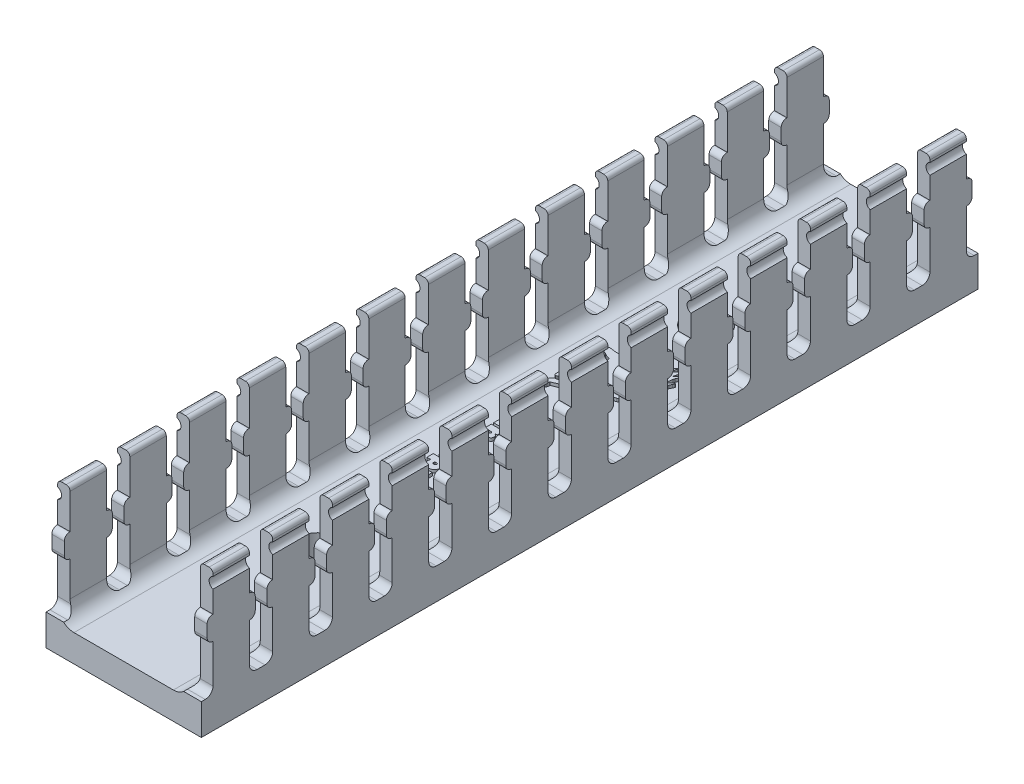
from build123d import *

# Parameters (mm, degrees)
BOSS_EXTRUDE1_DEPTH = 100
CUT_EXTRUDE1_DEPTH  = 104.556747728
SKETCH3_R           = 2.6
CUT_EXTRUDE2_DEPTH  = 104.006067899
BOSS_EXTRUDE2_DEPTH = 0.4
BOSS_EXTRUDE3_DEPTH = 0.4


with BuildPart() as part:
    # Sketch1 → Boss-Extrude1 (new body)
    with BuildSketch(Plane.XY):
        with BuildLine():
            Line((18.9, 18), (19.5, 18))
            ThreePointArc((19.5, 18), (19.853553391, 17.853553391), (20, 17.5))
            Line((20, 17.5), (20, 17.207106781))
            ThreePointArc((20, 17.207106781), (19.5, 16.5), (20, 15.792893219))
            Line((20, 15.792893219), (20, 0))
            Line((20, 0), (0, 0))
            Line((0, 0), (0, 15.792893219))
            ThreePointArc((0, 15.792893219), (0.5, 16.5), (0, 17.207106781))
            Line((0, 17.207106781), (0, 17.5))
            ThreePointArc((0, 17.5), (0.146446609, 17.853553391), (0.5, 18))
            Line((0.5, 18), (1.1, 18))
            ThreePointArc((1.1, 18), (1.453553391, 17.853553391), (1.6, 17.5))
            Line((1.6, 17.5), (1.6, 5.5))
            ThreePointArc((1.6, 5.5), (2.185786438, 4.085786438), (3.6, 3.5))
            Line((3.6, 3.5), (16.4, 3.5))
            ThreePointArc((16.4, 3.5), (17.814213562, 4.085786438), (18.4, 5.5))
            Line((18.4, 5.5), (18.4, 17.5))
            ThreePointArc((18.4, 17.5), (18.546446609, 17.853553391), (18.9, 18))
        make_face()
    extrude(amount=BOSS_EXTRUDE1_DEPTH)

    # Sketch2 → Cut-Extrude1 (cut, through all)
    with BuildSketch(Plane.ZY):
        with BuildLine():
            Line((-0.5, 4), (0.5, 4))
            ThreePointArc((0.5, 4), (1.207106781, 4.292893219), (1.5, 5))
            Line((1.5, 5), (1.5, 10))
            Line((1.5, 10), (1.45, 10))
            ThreePointArc((1.45, 10), (0.955025253, 10.205025253), (0.75, 10.7))
            Line((0.75, 10.7), (0.75, 12.3))
            ThreePointArc((0.75, 12.3), (0.955025253, 12.794974747), (1.45, 13))
            Line((1.45, 13), (1.5, 13))
            Line((1.5, 13), (1.5, 18))
            Line((1.5, 18), (-1.5, 18))
            Line((-1.5, 18), (-1.5, 13))
            Line((-1.5, 13), (-1.45, 13))
            ThreePointArc((-1.45, 13), (-0.955025253, 12.794974747), (-0.75, 12.3))
            Line((-0.75, 12.3), (-0.75, 10.7))
            ThreePointArc((-0.75, 10.7), (-0.955025253, 10.205025253), (-1.45, 10))
            Line((-1.45, 10), (-1.5, 10))
            Line((-1.5, 10), (-1.5, 5))
            ThreePointArc((-1.5, 5), (-1.207106781, 4.292893219), (-0.5, 4))
        make_face()
        with BuildLine():
            Line((7.192307692, 4), (8.192307692, 4))
            ThreePointArc((8.192307692, 4), (8.899414473, 4.292893219), (9.192307692, 5))
            Line((9.192307692, 5), (9.192307692, 10))
            Line((9.192307692, 10), (9.142307692, 10))
            ThreePointArc((9.142307692, 10), (8.647332945, 10.205025253), (8.442307692, 10.7))
            Line((8.442307692, 10.7), (8.442307692, 12.3))
            ThreePointArc((8.442307692, 12.3), (8.647332945, 12.794974747), (9.142307692, 13))
            Line((9.142307692, 13), (9.192307692, 13))
            Line((9.192307692, 13), (9.192307692, 18))
            Line((9.192307692, 18), (6.192307692, 18))
            Line((6.192307692, 18), (6.192307692, 13))
            Line((6.192307692, 13), (6.242307692, 13))
            ThreePointArc((6.242307692, 13), (6.737282439, 12.794974747), (6.942307692, 12.3))
            Line((6.942307692, 12.3), (6.942307692, 10.7))
            ThreePointArc((6.942307692, 10.7), (6.737282439, 10.205025253), (6.242307692, 10))
            Line((6.242307692, 10), (6.192307692, 10))
            Line((6.192307692, 10), (6.192307692, 5))
            ThreePointArc((6.192307692, 5), (6.485200911, 4.292893219), (7.192307692, 4))
        make_face()
        with BuildLine():
            Line((14.884615385, 4), (15.884615385, 4))
            ThreePointArc((15.884615385, 4), (16.591722166, 4.292893219), (16.884615385, 5))
            Line((16.884615385, 5), (16.884615385, 10))
            Line((16.884615385, 10), (16.834615385, 10))
            ThreePointArc((16.834615385, 10), (16.339640638, 10.205025253), (16.134615385, 10.7))
            Line((16.134615385, 10.7), (16.134615385, 12.3))
            ThreePointArc((16.134615385, 12.3), (16.339640638, 12.794974747), (16.834615385, 13))
            Line((16.834615385, 13), (16.884615385, 13))
            Line((16.884615385, 13), (16.884615385, 18))
            Line((16.884615385, 18), (13.884615385, 18))
            Line((13.884615385, 18), (13.884615385, 13))
            Line((13.884615385, 13), (13.934615385, 13))
            ThreePointArc((13.934615385, 13), (14.429590131, 12.794974747), (14.634615385, 12.3))
            Line((14.634615385, 12.3), (14.634615385, 10.7))
            ThreePointArc((14.634615385, 10.7), (14.429590131, 10.205025253), (13.934615385, 10))
            Line((13.934615385, 10), (13.884615385, 10))
            Line((13.884615385, 10), (13.884615385, 5))
            ThreePointArc((13.884615385, 5), (14.177508603, 4.292893219), (14.884615385, 4))
        make_face()
        with BuildLine():
            Line((22.576923077, 4), (23.576923077, 4))
            ThreePointArc((23.576923077, 4), (24.284029858, 4.292893219), (24.576923077, 5))
            Line((24.576923077, 5), (24.576923077, 10))
            Line((24.576923077, 10), (24.526923077, 10))
            ThreePointArc((24.526923077, 10), (24.03194833, 10.205025253), (23.826923077, 10.7))
            Line((23.826923077, 10.7), (23.826923077, 12.3))
            ThreePointArc((23.826923077, 12.3), (24.03194833, 12.794974747), (24.526923077, 13))
            Line((24.526923077, 13), (24.576923077, 13))
            Line((24.576923077, 13), (24.576923077, 18))
            Line((24.576923077, 18), (21.576923077, 18))
            Line((21.576923077, 18), (21.576923077, 13))
            Line((21.576923077, 13), (21.626923077, 13))
            ThreePointArc((21.626923077, 13), (22.121897824, 12.794974747), (22.326923077, 12.3))
            Line((22.326923077, 12.3), (22.326923077, 10.7))
            ThreePointArc((22.326923077, 10.7), (22.121897824, 10.205025253), (21.626923077, 10))
            Line((21.626923077, 10), (21.576923077, 10))
            Line((21.576923077, 10), (21.576923077, 5))
            ThreePointArc((21.576923077, 5), (21.869816296, 4.292893219), (22.576923077, 4))
        make_face()
        with BuildLine():
            Line((30.269230769, 4), (31.269230769, 4))
            ThreePointArc((31.269230769, 4), (31.97633755, 4.292893219), (32.269230769, 5))
            Line((32.269230769, 5), (32.269230769, 10))
            Line((32.269230769, 10), (32.219230769, 10))
            ThreePointArc((32.219230769, 10), (31.724256022, 10.205025253), (31.519230769, 10.7))
            Line((31.519230769, 10.7), (31.519230769, 12.3))
            ThreePointArc((31.519230769, 12.3), (31.724256022, 12.794974747), (32.219230769, 13))
            Line((32.219230769, 13), (32.269230769, 13))
            Line((32.269230769, 13), (32.269230769, 18))
            Line((32.269230769, 18), (29.269230769, 18))
            Line((29.269230769, 18), (29.269230769, 13))
            Line((29.269230769, 13), (29.319230769, 13))
            ThreePointArc((29.319230769, 13), (29.814205516, 12.794974747), (30.019230769, 12.3))
            Line((30.019230769, 12.3), (30.019230769, 10.7))
            ThreePointArc((30.019230769, 10.7), (29.814205516, 10.205025253), (29.319230769, 10))
            Line((29.319230769, 10), (29.269230769, 10))
            Line((29.269230769, 10), (29.269230769, 5))
            ThreePointArc((29.269230769, 5), (29.562123988, 4.292893219), (30.269230769, 4))
        make_face()
        with BuildLine():
            Line((37.961538462, 4), (38.961538462, 4))
            ThreePointArc((38.961538462, 4), (39.668645243, 4.292893219), (39.961538462, 5))
            Line((39.961538462, 5), (39.961538462, 10))
            Line((39.961538462, 10), (39.911538462, 10))
            ThreePointArc((39.911538462, 10), (39.416563715, 10.205025253), (39.211538462, 10.7))
            Line((39.211538462, 10.7), (39.211538462, 12.3))
            ThreePointArc((39.211538462, 12.3), (39.416563715, 12.794974747), (39.911538462, 13))
            Line((39.911538462, 13), (39.961538462, 13))
            Line((39.961538462, 13), (39.961538462, 18))
            Line((39.961538462, 18), (36.961538462, 18))
            Line((36.961538462, 18), (36.961538462, 13))
            Line((36.961538462, 13), (37.011538462, 13))
            ThreePointArc((37.011538462, 13), (37.506513208, 12.794974747), (37.711538462, 12.3))
            Line((37.711538462, 12.3), (37.711538462, 10.7))
            ThreePointArc((37.711538462, 10.7), (37.506513208, 10.205025253), (37.011538462, 10))
            Line((37.011538462, 10), (36.961538462, 10))
            Line((36.961538462, 10), (36.961538462, 5))
            ThreePointArc((36.961538462, 5), (37.25443168, 4.292893219), (37.961538462, 4))
        make_face()
        with BuildLine():
            Line((45.653846154, 4), (46.653846154, 4))
            ThreePointArc((46.653846154, 4), (47.360952935, 4.292893219), (47.653846154, 5))
            Line((47.653846154, 5), (47.653846154, 10))
            Line((47.653846154, 10), (47.603846154, 10))
            ThreePointArc((47.603846154, 10), (47.108871407, 10.205025253), (46.903846154, 10.7))
            Line((46.903846154, 10.7), (46.903846154, 12.3))
            ThreePointArc((46.903846154, 12.3), (47.108871407, 12.794974747), (47.603846154, 13))
            Line((47.603846154, 13), (47.653846154, 13))
            Line((47.653846154, 13), (47.653846154, 18))
            Line((47.653846154, 18), (44.653846154, 18))
            Line((44.653846154, 18), (44.653846154, 13))
            Line((44.653846154, 13), (44.703846154, 13))
            ThreePointArc((44.703846154, 13), (45.198820901, 12.794974747), (45.403846154, 12.3))
            Line((45.403846154, 12.3), (45.403846154, 10.7))
            ThreePointArc((45.403846154, 10.7), (45.198820901, 10.205025253), (44.703846154, 10))
            Line((44.703846154, 10), (44.653846154, 10))
            Line((44.653846154, 10), (44.653846154, 5))
            ThreePointArc((44.653846154, 5), (44.946739373, 4.292893219), (45.653846154, 4))
        make_face()
        with BuildLine():
            Line((53.346153846, 4), (54.346153846, 4))
            ThreePointArc((54.346153846, 4), (55.053260627, 4.292893219), (55.346153846, 5))
            Line((55.346153846, 5), (55.346153846, 10))
            Line((55.346153846, 10), (55.296153846, 10))
            ThreePointArc((55.296153846, 10), (54.801179099, 10.205025253), (54.596153846, 10.7))
            Line((54.596153846, 10.7), (54.596153846, 12.3))
            ThreePointArc((54.596153846, 12.3), (54.801179099, 12.794974747), (55.296153846, 13))
            Line((55.296153846, 13), (55.346153846, 13))
            Line((55.346153846, 13), (55.346153846, 18))
            Line((55.346153846, 18), (52.346153846, 18))
            Line((52.346153846, 18), (52.346153846, 13))
            Line((52.346153846, 13), (52.396153846, 13))
            ThreePointArc((52.396153846, 13), (52.891128593, 12.794974747), (53.096153846, 12.3))
            Line((53.096153846, 12.3), (53.096153846, 10.7))
            ThreePointArc((53.096153846, 10.7), (52.891128593, 10.205025253), (52.396153846, 10))
            Line((52.396153846, 10), (52.346153846, 10))
            Line((52.346153846, 10), (52.346153846, 5))
            ThreePointArc((52.346153846, 5), (52.639047065, 4.292893219), (53.346153846, 4))
        make_face()
        with BuildLine():
            Line((61.038461538, 4), (62.038461538, 4))
            ThreePointArc((62.038461538, 4), (62.74556832, 4.292893219), (63.038461538, 5))
            Line((63.038461538, 5), (63.038461538, 10))
            Line((63.038461538, 10), (62.988461538, 10))
            ThreePointArc((62.988461538, 10), (62.493486792, 10.205025253), (62.288461538, 10.7))
            Line((62.288461538, 10.7), (62.288461538, 12.3))
            ThreePointArc((62.288461538, 12.3), (62.493486792, 12.794974747), (62.988461538, 13))
            Line((62.988461538, 13), (63.038461538, 13))
            Line((63.038461538, 13), (63.038461538, 18))
            Line((63.038461538, 18), (60.038461538, 18))
            Line((60.038461538, 18), (60.038461538, 13))
            Line((60.038461538, 13), (60.088461538, 13))
            ThreePointArc((60.088461538, 13), (60.583436285, 12.794974747), (60.788461538, 12.3))
            Line((60.788461538, 12.3), (60.788461538, 10.7))
            ThreePointArc((60.788461538, 10.7), (60.583436285, 10.205025253), (60.088461538, 10))
            Line((60.088461538, 10), (60.038461538, 10))
            Line((60.038461538, 10), (60.038461538, 5))
            ThreePointArc((60.038461538, 5), (60.331354757, 4.292893219), (61.038461538, 4))
        make_face()
        with BuildLine():
            Line((68.730769231, 4), (69.730769231, 4))
            ThreePointArc((69.730769231, 4), (70.437876012, 4.292893219), (70.730769231, 5))
            Line((70.730769231, 5), (70.730769231, 10))
            Line((70.730769231, 10), (70.680769231, 10))
            ThreePointArc((70.680769231, 10), (70.185794484, 10.205025253), (69.980769231, 10.7))
            Line((69.980769231, 10.7), (69.980769231, 12.3))
            ThreePointArc((69.980769231, 12.3), (70.185794484, 12.794974747), (70.680769231, 13))
            Line((70.680769231, 13), (70.730769231, 13))
            Line((70.730769231, 13), (70.730769231, 18))
            Line((70.730769231, 18), (67.730769231, 18))
            Line((67.730769231, 18), (67.730769231, 13))
            Line((67.730769231, 13), (67.780769231, 13))
            ThreePointArc((67.780769231, 13), (68.275743978, 12.794974747), (68.480769231, 12.3))
            Line((68.480769231, 12.3), (68.480769231, 10.7))
            ThreePointArc((68.480769231, 10.7), (68.275743978, 10.205025253), (67.780769231, 10))
            Line((67.780769231, 10), (67.730769231, 10))
            Line((67.730769231, 10), (67.730769231, 5))
            ThreePointArc((67.730769231, 5), (68.02366245, 4.292893219), (68.730769231, 4))
        make_face()
        with BuildLine():
            Line((76.423076923, 4), (77.423076923, 4))
            ThreePointArc((77.423076923, 4), (78.130183704, 4.292893219), (78.423076923, 5))
            Line((78.423076923, 5), (78.423076923, 10))
            Line((78.423076923, 10), (78.373076923, 10))
            ThreePointArc((78.373076923, 10), (77.878102176, 10.205025253), (77.673076923, 10.7))
            Line((77.673076923, 10.7), (77.673076923, 12.3))
            ThreePointArc((77.673076923, 12.3), (77.878102176, 12.794974747), (78.373076923, 13))
            Line((78.373076923, 13), (78.423076923, 13))
            Line((78.423076923, 13), (78.423076923, 18))
            Line((78.423076923, 18), (75.423076923, 18))
            Line((75.423076923, 18), (75.423076923, 13))
            Line((75.423076923, 13), (75.473076923, 13))
            ThreePointArc((75.473076923, 13), (75.96805167, 12.794974747), (76.173076923, 12.3))
            Line((76.173076923, 12.3), (76.173076923, 10.7))
            ThreePointArc((76.173076923, 10.7), (75.96805167, 10.205025253), (75.473076923, 10))
            Line((75.473076923, 10), (75.423076923, 10))
            Line((75.423076923, 10), (75.423076923, 5))
            ThreePointArc((75.423076923, 5), (75.715970142, 4.292893219), (76.423076923, 4))
        make_face()
        with BuildLine():
            Line((84.115384615, 4), (85.115384615, 4))
            ThreePointArc((85.115384615, 4), (85.822491397, 4.292893219), (86.115384615, 5))
            Line((86.115384615, 5), (86.115384615, 10))
            Line((86.115384615, 10), (86.065384615, 10))
            ThreePointArc((86.065384615, 10), (85.570409869, 10.205025253), (85.365384615, 10.7))
            Line((85.365384615, 10.7), (85.365384615, 12.3))
            ThreePointArc((85.365384615, 12.3), (85.570409869, 12.794974747), (86.065384615, 13))
            Line((86.065384615, 13), (86.115384615, 13))
            Line((86.115384615, 13), (86.115384615, 18))
            Line((86.115384615, 18), (83.115384615, 18))
            Line((83.115384615, 18), (83.115384615, 13))
            Line((83.115384615, 13), (83.165384615, 13))
            ThreePointArc((83.165384615, 13), (83.660359362, 12.794974747), (83.865384615, 12.3))
            Line((83.865384615, 12.3), (83.865384615, 10.7))
            ThreePointArc((83.865384615, 10.7), (83.660359362, 10.205025253), (83.165384615, 10))
            Line((83.165384615, 10), (83.115384615, 10))
            Line((83.115384615, 10), (83.115384615, 5))
            ThreePointArc((83.115384615, 5), (83.408277834, 4.292893219), (84.115384615, 4))
        make_face()
        with BuildLine():
            Line((91.807692308, 4), (92.807692308, 4))
            ThreePointArc((92.807692308, 4), (93.514799089, 4.292893219), (93.807692308, 5))
            Line((93.807692308, 5), (93.807692308, 10))
            Line((93.807692308, 10), (93.757692308, 10))
            ThreePointArc((93.757692308, 10), (93.262717561, 10.205025253), (93.057692308, 10.7))
            Line((93.057692308, 10.7), (93.057692308, 12.3))
            ThreePointArc((93.057692308, 12.3), (93.262717561, 12.794974747), (93.757692308, 13))
            Line((93.757692308, 13), (93.807692308, 13))
            Line((93.807692308, 13), (93.807692308, 18))
            Line((93.807692308, 18), (90.807692308, 18))
            Line((90.807692308, 18), (90.807692308, 13))
            Line((90.807692308, 13), (90.857692308, 13))
            ThreePointArc((90.857692308, 13), (91.352667055, 12.794974747), (91.557692308, 12.3))
            Line((91.557692308, 12.3), (91.557692308, 10.7))
            ThreePointArc((91.557692308, 10.7), (91.352667055, 10.205025253), (90.857692308, 10))
            Line((90.857692308, 10), (90.807692308, 10))
            Line((90.807692308, 10), (90.807692308, 5))
            ThreePointArc((90.807692308, 5), (91.100585527, 4.292893219), (91.807692308, 4))
        make_face()
        with BuildLine():
            Line((99.5, 4), (100.5, 4))
            ThreePointArc((100.5, 4), (101.207106781, 4.292893219), (101.5, 5))
            Line((101.5, 5), (101.5, 10))
            Line((101.5, 10), (101.45, 10))
            ThreePointArc((101.45, 10), (100.955025253, 10.205025253), (100.75, 10.7))
            Line((100.75, 10.7), (100.75, 12.3))
            ThreePointArc((100.75, 12.3), (100.955025253, 12.794974747), (101.45, 13))
            Line((101.45, 13), (101.5, 13))
            Line((101.5, 13), (101.5, 18))
            Line((101.5, 18), (98.5, 18))
            Line((98.5, 18), (98.5, 13))
            Line((98.5, 13), (98.55, 13))
            ThreePointArc((98.55, 13), (99.044974747, 12.794974747), (99.25, 12.3))
            Line((99.25, 12.3), (99.25, 10.7))
            ThreePointArc((99.25, 10.7), (99.044974747, 10.205025253), (98.55, 10))
            Line((98.55, 10), (98.5, 10))
            Line((98.5, 10), (98.5, 5))
            ThreePointArc((98.5, 5), (98.792893219, 4.292893219), (99.5, 4))
        make_face()
    extrude(amount=-CUT_EXTRUDE1_DEPTH, mode=Mode.SUBTRACT)

    # Sketch3 → Cut-Extrude2 (cut, through all)
    with BuildSketch(Plane(origin=(0, 3.5, 0), x_dir=(1, 0, 0), z_dir=(0, 1, 0))):
        with Locations((10, -25)):
            Circle(SKETCH3_R)
        with Locations((10, -75)):
            Circle(SKETCH3_R)
    extrude(amount=-CUT_EXTRUDE2_DEPTH, mode=Mode.SUBTRACT)

    # Sketch5 → Boss-Extrude2 (add)
    with BuildSketch(Plane(origin=(2.865800493, 3.5, -37.480386566), x_dir=(1, 0, 0), z_dir=(0, 1, 0))):
        Polygon((12.100966892, -71.436643223), (12.11467057, -71.389617273), (12.079708439, -71.401613946), (12.04555004, -71.41492974), (12.012164966, -71.42950559), (11.979522808, -71.445282431), (11.947593159, -71.462201197), (11.916345609, -71.480202824), (11.88574975, -71.499228247), (11.855775175, -71.519218401), (11.826391475, -71.540114221), (11.797568242, -71.561856642), (11.769275066, -71.584386599), (11.741481541, -71.607645027), (11.714157258, -71.63157286), (11.660794784, -71.681200486), (11.583510179, -71.759185845), (11.315972457, -72.057260394), (11.322057411, -71.994274898), (11.457026474, -71.151822537), (11.461838625, -71.120101737), (11.467543035, -71.088672942), (11.474089535, -71.057519752), (11.481427956, -71.026625766), (11.498279887, -70.965549806), (11.517697482, -70.905313862), (11.55075654, -70.81624797), (11.729620086, -70.408683531), (11.775519845, -70.290546976), (11.745148512, -70.295900967), (11.715561816, -70.302766086), (11.686726412, -70.3110697), (11.658608952, -70.320739177), (11.631176091, -70.331701886), (11.604394482, -70.343885194), (11.578230779, -70.357216469), (11.552651635, -70.371623079), (11.527623705, -70.387032393), (11.503113642, -70.403371777), (11.4790881, -70.4205686), (11.455513733, -70.43855023), (11.409585136, -70.476577382), (11.365061083, -70.516872176), (11.279159523, -70.601940467), (11.091466646, -70.793932915), (11.111121267, -70.7091724), (11.155635515, -70.541181539), (11.206430997, -70.375104174), (11.292672243, -70.129243265), (11.509197294, -69.607695097), (11.491309846, -69.60960645), (11.456105432, -69.6153531), (11.421652842, -69.623517379), (11.387941493, -69.633922128), (11.338741142, -69.653342599), (11.29114905, -69.676807615), (11.215305789, -69.723279905), (11.063011614, -69.845578229), (10.677313831, -70.268847424), (10.549453829, -70.445689406), (10.381519842, -70.666292122), (10.531069748, -69.981539585), (10.609634043, -69.570531114), (10.571823714, -69.591783074), (10.535674259, -69.614647546), (10.501108461, -69.639043472), (10.468049103, -69.664889794), (10.436418969, -69.692105455), (10.406140841, -69.720609396), (10.377137504, -69.75032056), (10.349331739, -69.781157888), (10.32264633, -69.813040324), (10.297004059, -69.845886808), (10.272327712, -69.879616284), (10.248540069, -69.914147693), (10.225563915, -69.949399978), (10.203322032, -69.98529208), (10.160732213, -70.058671506), (10.100424098, -70.17151283), (9.945862574, -70.473231487), (9.905298881, -70.545332385), (9.86876705, -70.236548595), (9.854633501, -70.245400277), (9.827975459, -70.264675745), (9.803350582, -70.285895191), (9.780624175, -70.30887602), (9.759661545, -70.333435638), (9.731230037, -70.372835865), (9.69823743, -70.429191038), (9.617410212, -70.625694239), (9.598468184, -70.686080194), (9.409863745, -71.518454363), (9.297442291, -71.347754027), (9.281809574, -71.436764932), (9.210015106, -71.885042629), (9.189060794, -71.973144388), (9.172482006, -72.031203428), (9.153427216, -72.088613534), (9.131563335, -72.145281649), (9.119473894, -72.17330838), (9.106557272, -72.201114719), (9.034917781, -72.130719675), (8.916117918, -72.249525773), (8.872854665, -72.314086443), (8.854678116, -72.354859037), (8.84495761, -72.387618518), (8.839927938, -72.408850556), (8.827776868, -72.472878119), (8.815486987, -72.580491147), (8.794635922, -73.01424944), (8.69060925, -72.955782311), (8.673627111, -72.999373161), (8.644829875, -73.087991959), (8.622557018, -73.17823391), (8.603223574, -73.292783307), (8.591372055, -73.431898386), (8.592400982, -73.618246697), (8.49359264, -73.639163066), (8.470079751, -73.654432067), (8.459131619, -73.667697842), (8.453474206, -73.678604379), (8.449311778, -73.691358481), (8.44589947, -73.707040048), (8.441401599, -73.738322392), (8.439773621, -73.769487021), (8.440736615, -73.80052194), (8.444011664, -73.831415158), (8.456382248, -73.89272851), (8.542562939, -74.129915068), (8.386627955, -74.071919291), (8.392067413, -74.691386997), (8.390261584, -74.715039228), (8.387498798, -74.738419387), (8.383806828, -74.761522735), (8.379213444, -74.784344532), (8.373746417, -74.806880038), (8.367433518, -74.829124515), (8.36030252, -74.851073222), (8.352381192, -74.872721421), (8.343697307, -74.89406437), (8.334278635, -74.915097332), (8.313348017, -74.956214333), (8.289811507, -74.996034507), (8.263891275, -75.034519938), (8.235809491, -75.07163271), (8.205788326, -75.107334905), (8.157606232, -75.158160428), (8.106310233, -75.205598875), (8.052650153, -75.249522281), (8.005604859, -75.009097819), (8.011423944, -74.972177762), (8.018250421, -74.935524179), (8.026005087, -74.899116309), (8.034608743, -74.862933387), (8.054046211, -74.791159339), (8.087589786, -74.684666317), (8.223101076, -74.297657289), (8.244361635, -74.226437524), (8.26299882, -74.154539585), (8.271135643, -74.118284394), (8.278379017, -74.08179737), (8.284649741, -74.045057752), (8.289868613, -74.008044776), (8.293956431, -73.970737681), (8.297283604, -73.939856944), (8.302167608, -73.87788295), (8.304665172, -73.815721412), (8.30474511, -73.753487307), (8.302376238, -73.69129561), (8.29752737, -73.629261298), (8.290167323, -73.567499349), (8.28026491, -73.506124739), (8.267788948, -73.445252445), (8.252708251, -73.384997443), (8.234991635, -73.325474711), (8.214607916, -73.266799224), (8.191525907, -73.209085961), (8.165714424, -73.152449897), (8.137142283, -73.09700601), (8.062692647, -72.962171163), (8.010570766, -72.873329923), (7.956344141, -72.785593594), (7.899915308, -72.699190164), (7.841186798, -72.61434762), (7.780061147, -72.53129395), (7.748568935, -72.49050919), (7.716440888, -72.450257143), (7.683664822, -72.410566308), (7.650228555, -72.371465184), (7.616119902, -72.33298227), (7.581326681, -72.295146063), (7.545836709, -72.257985062), (7.509637801, -72.221527766), (7.472717776, -72.185802672), (7.435064449, -72.150838281), (7.396665637, -72.116663089), (7.357509157, -72.083305595), (7.317582826, -72.050794299), (7.27687446, -72.019157697), (7.235371877, -71.98842429), (7.193062892, -71.958622574), (6.622026328, -71.556560339), (6.585943606, -71.533506579), (6.135220615, -71.174355636), (6.032107543, -71.09097231), (5.931797706, -71.004338486), (5.802308401, -70.884112314), (5.677554365, -70.758928095), (5.557393736, -70.629254751), (5.413436308, -70.461564615), (5.249478585, -70.253334325), (5.167010913, -70.134652629), (5.138774148, -70.074512669), (5.130306063, -70.037559993), (5.128832282, -70.008295108), (5.128345853, -69.994514714), (5.128791136, -69.980872638), (5.130088602, -69.967357882), (5.134921955, -69.940666329), (5.142209664, -69.914352061), (5.197731287, -69.772435246), (5.208500661, -69.733324526), (5.212518249, -69.706860697), (5.213339852, -69.693478778), (5.213263953, -69.679982192), (5.21221102, -69.666359939), (5.210101522, -69.652601018), (5.206855928, -69.638694431), (5.202394708, -69.624629179), (5.044255478, -69.164968193), (4.957685888, -69.185230181), (4.832796788, -68.863274956), (4.759556079, -68.956672394), (4.586234914, -68.76416058), (4.523166652, -68.852885018), (4.480019014, -68.834549837), (4.30181836, -68.779828676), (4.178877168, -68.763372791), (4.084999464, -68.763605787), (4.080549464, -68.898207278), (3.886761497, -69.085123973), (3.957782774, -69.117937683), (4.088556656, -69.179940558), (4.119579515, -69.202269482), (4.138247365, -69.219398976), (4.154985945, -69.238656959), (4.162546574, -69.249173505), (4.169522664, -69.260329419), (4.17588014, -69.27216045), (4.181584929, -69.284702345), (4.186602956, -69.297990854), (4.05514173, -69.326800388), (4.064188834, -69.36946213), (4.096182787, -69.464968608), (4.23350752, -69.701450668), (4.195085023, -69.815628097), (4.194202994, -69.878750833), (4.205063736, -69.902537721), (4.237709828, -69.958277378), (4.432524827, -70.165140248), (4.446040728, -70.177385345), (4.484270541, -70.215997255), (4.541706711, -70.285444548), (4.749186783, -70.581749186), (4.786366383, -70.631631939), (4.824316507, -70.68082531), (4.863010491, -70.729349429), (4.902421672, -70.777224423), (4.942523385, -70.824470421), (4.983288968, -70.871107553), (5.024691756, -70.917155945), (5.066705087, -70.962635728), (5.109302297, -71.00756703), (5.196141697, -71.095864703), (5.284996649, -71.182209993), (5.375653844, -71.266763929), (5.467899974, -71.34968754), (5.608781808, -71.471368344), (6.042799092, -71.822009962), (6.065908939, -71.84415392), (6.113266498, -71.886936691), (6.186757156, -71.947868446), (6.339997717, -72.061494398), (6.702082776, -72.321150684), (6.775408859, -72.382578248), (6.512041716, -72.398067776), (6.450441638, -72.390610652), (6.414140656, -72.381089212), (6.335197635, -72.321192749), (5.800956641, -71.87757472), (5.667872095, -71.779772619), (5.641731172, -71.763332947), (5.615195199, -71.748703455), (5.588286261, -71.735796264), (5.561026446, -71.724523496), (5.533437841, -71.714797273), (5.50554253, -71.706529718), (5.477362602, -71.699632952), (5.448920143, -71.694019098), (5.420237238, -71.689600277), (5.391335976, -71.686288612), (5.362238441, -71.683996224), (5.332966722, -71.682635236), (5.273989073, -71.682355946), (5.184768373, -71.686725561), (4.888007538, -71.714231358), (4.830098993, -71.71684884), (4.253301759, -71.664301396), (4.18367508, -71.65479654), (3.920654037, -71.614675031), (3.868049644, -71.613865602), (3.83304126, -71.616019543), (3.798098992, -71.620708426), (3.763237541, -71.628258043), (3.745841714, -71.633207438), (3.733136593, -71.637802751), (3.721004367, -71.643050475), (3.709414823, -71.648915748), (3.687742928, -71.662359486), (3.667879202, -71.677855059), (3.64958194, -71.695123561), (3.609105868, -71.744221051), (3.499589559, -71.903960193), (3.465120853, -71.947528581), (3.329694205, -72.092512914), (3.306171165, -72.126614805), (3.293073028, -72.150751933), (3.282485894, -72.176249138), (3.278252851, -72.189571533), (3.274790238, -72.203310462), (3.272145615, -72.217491432), (3.27036654, -72.232139947), (3.268193349, -72.262134875), (3.268529502, -73.103671768), (3.270403167, -73.12436859), (3.291472826, -73.192360396), (3.315700117, -73.226586598), (3.33695896, -73.244109053), (3.355679991, -73.253598102), (3.376844229, -73.259380641), (3.522674067, -73.270350521), (3.57123709, -73.265737083), (3.606160965, -73.257643691), (3.628395517, -73.249608741), (3.649583503, -73.239192877), (3.66954652, -73.226165156), (3.679012912, -73.21859968), (3.68810616, -73.210294637), (3.696803962, -73.20122116), (3.705084018, -73.19135038), (3.720015534, -73.175487191), (3.734118945, -73.159095431), (3.747399746, -73.142202101), (3.759863432, -73.124834202), (3.771515498, -73.107018734), (3.782361439, -73.088782699), (3.792406751, -73.070153097), (3.801656928, -73.051156931), (3.810117466, -73.031821199), (3.81779386, -73.012172904), (3.824691605, -72.992239047), (3.830816196, -72.972046628), (3.836173129, -72.951622648), (3.840767897, -72.930994109), (3.844605998, -72.910188011), (3.850034173, -72.868151142), (3.852501617, -72.825728051), (3.852052289, -72.783134743), (3.848730152, -72.740587228), (3.842579165, -72.698301512), (3.833643291, -72.656493604), (3.82196649, -72.615379511), (4.14594779, -72.470566166), (4.37697809, -72.629213709), (4.510280804, -72.703739906), (4.602452885, -72.746589436), (4.67346138, -72.77444771), (4.746176449, -72.798182967), (4.795643761, -72.8115135), (5.024199833, -72.872576664), (5.151333313, -73.228595621), (5.16206961, -73.257818558), (5.185353846, -73.348539649), (5.231282933, -73.562588499), (5.247908503, -73.605947252), (5.261668984, -73.633884963), (5.277967786, -73.660907821), (5.305479469, -73.691932293), (5.379150011, -73.764203853), (5.743682356, -74.036265175), (5.712437634, -74.121291694), (5.664577122, -74.210118769), (5.636577203, -74.244488556), (5.612118792, -74.267344722), (5.584298925, -74.287237404), (5.563708405, -74.298648536), (5.313577016, -74.209574815), (5.009651014, -74.115147807), (4.905884779, -74.092911772), (4.82688348, -74.080757639), (4.790581342, -74.075763204), (4.582954777, -74.052145254), (4.526359994, -74.052353266), (4.489201711, -74.05538893), (4.452698182, -74.061202023), (4.434744851, -74.065273278), (4.417018689, -74.070186695), (4.399540858, -74.075991545), (4.382332517, -74.082737095), (4.365414826, -74.090472614), (4.348808946, -74.09924737), (4.332536038, -74.109110632), (4.316617261, -74.120111669), (4.301073776, -74.132299749), (4.27824442, -74.151305466), (4.211988557, -74.21058348), (4.107728651, -74.315611469), (3.71822015, -74.762868059), (3.424326868, -74.997251356), (3.32313528, -75.098229468), (3.302378656, -75.174700893), (3.264276051, -75.554378183), (3.26332457, -75.770801166), (3.272821819, -75.860793016), (3.283565409, -75.913487029), (3.293299097, -75.947814034), (3.305352521, -75.981353447), (3.319950854, -76.013980366), (3.337319269, -76.045569887), (3.347112623, -76.060936592), (3.36883315, -76.071958708), (3.402880063, -76.084666087), (3.438307551, -76.093040653), (3.486955253, -76.097968747), (3.536289693, -76.096398717), (3.609369464, -76.083365508), (3.689161798, -76.054738103), (3.699171388, -76.045811556), (3.708429645, -76.036456482), (3.716973094, -76.026695799), (3.73206168, -76.006049269), (3.744729362, -75.984055301), (3.755268354, -75.96089723), (3.771129134, -75.911822115), (3.807867769, -75.705624388), (3.809581589, -75.689438596), (3.812169698, -75.673706063), (3.815585112, -75.658402478), (3.819780846, -75.64350353), (3.830325342, -75.614822305), (3.843427312, -75.587467903), (3.867053312, -75.548498659), (3.98527201, -75.404971608), (4.040850218, -75.331428649), (4.134516602, -75.198509781), (4.163643986, -75.171578054), (4.188336109, -75.15529579), (4.206404129, -75.146727697), (4.225913665, -75.140251416), (4.24699863, -75.136091873), (4.269258275, -75.129548087), (4.291518908, -75.124098097), (4.313778395, -75.119692802), (4.3360346, -75.116283101), (4.358285389, -75.113819894), (4.380528627, -75.112254081), (4.402762179, -75.111536561), (4.424983909, -75.111618234), (4.469383365, -75.113982755), (4.513709916, -75.11895484), (4.580025682, -75.130442894), (4.88512845, -75.210989898), (4.916959884, -75.220966064), (4.947453932, -75.233342081), (4.991097146, -75.255680587), (5.073149233, -75.309842953), (5.248191437, -75.433048601), (5.292174643, -75.455324432), (5.509106379, -75.555126582), (5.499771275, -75.597867642), (5.456618737, -75.744116263), (5.313569867, -76.155996416), (5.279814654, -76.261228926), (5.237220372, -76.365752561), (5.211145152, -76.415372257), (5.191594538, -76.44682808), (5.170107868, -76.476656147), (5.146511696, -76.504574826), (5.133868347, -76.517730134), (5.120632582, -76.530302482), (5.106782719, -76.542256665), (5.092297079, -76.553557479), (5.077153982, -76.56416972), (5.061331747, -76.574058183), (5.044808693, -76.583187665), (5.02756314, -76.59152296), (5.005240678, -76.59837239), (4.982810099, -76.60416151), (4.960278732, -76.608964945), (4.937653906, -76.612857316), (4.91494295, -76.615913246), (4.869291964, -76.619814272), (4.800352729, -76.621258066), (4.54583431, -76.611944122), (4.476817449, -76.614300077), (4.431096229, -76.619026391), (4.408344612, -76.622560119), (4.385675428, -76.626973724), (4.363096007, -76.63234183), (4.333608049, -76.643202288), (4.277389204, -76.669938625), (4.042425332, -76.823911392), (3.973416121, -76.860416775), (3.945920446, -76.874919196), (3.917603176, -76.886979146), (3.859054323, -76.905394785), (3.648482954, -76.9525625), (3.605287596, -76.968225446), (3.577413288, -76.981362982), (3.550437613, -76.997130396), (3.521492532, -77.016818976), (3.309394408, -77.232382481), (3.296505657, -77.251360207), (3.286142092, -77.271099616), (3.274759665, -77.301944248), (3.265981554, -77.344914395), (3.263059626, -77.546196173), (3.263791462, -77.564716386), (3.265643593, -77.956112206), (3.275220722, -78.029651541), (3.287088445, -78.084243572), (3.29741906, -78.100527137), (3.308937135, -78.115416117), (3.321549777, -78.128926325), (3.335164092, -78.141073572), (3.349687188, -78.151873669), (3.365026173, -78.161342428), (3.381088152, -78.169495662), (3.397780232, -78.17634918), (3.415009522, -78.181918795), (3.432683127, -78.186220319), (3.450708155, -78.189269563), (3.468991712, -78.191082338), (3.487440906, -78.191674456), (3.505962843, -78.191061728), (3.524464631, -78.189259967), (3.542853377, -78.186284984), (3.561036187, -78.18215259), (3.578920168, -78.176878597), (3.596412428, -78.170478816), (3.613420073, -78.16296906), (3.62985021, -78.154365138), (3.645609947, -78.144682864), (3.66060639, -78.133938049), (3.674746646, -78.122146504), (3.687937823, -78.10932404), (3.700087026, -78.09548647), (3.711101364, -78.080649605), (3.720887943, -78.064829257), (3.72935387, -78.048041236), (3.739845472, -78.013190442), (3.74798353, -77.977588367), (3.775453824, -77.757313544), (3.788502632, -77.685256784), (3.798012127, -77.650217356), (3.810179929, -77.616054242), (3.817417316, -77.599352165), (3.825507225, -77.582930201), (3.834512302, -77.566808695), (3.844495198, -77.551007993), (3.855518559, -77.535548439), (3.88222, -77.529964999), (3.935493598, -77.524353413), (4.001739139, -77.526310665), (4.234686099, -77.583278659), (4.25393016, -77.588686668), (4.273185888, -77.593146751), (4.292452678, -77.596713372), (4.311729923, -77.599440994), (4.331017017, -77.601384081), (4.369618331, -77.603134502), (4.408251772, -77.602400341), (4.466251565, -77.597593618), (4.73724808, -77.557415801), (4.795286636, -77.55426223), (5.273923026, -77.542223546), (5.363959746, -77.753183753), (5.300474203, -77.773743293), (5.238034548, -77.796703314), (5.176582943, -77.82188814), (5.086131611, -77.863452595), (4.997578053, -77.90903468), (4.882121348, -77.975035661), (4.522198629, -78.21460111), (4.284300998, -78.382670803), (4.175389629, -78.443045033), (4.099454663, -78.476323663), (4.040469633, -78.496745456), (4.00008321, -78.507910144), (3.705692644, -78.567105584), (3.638584266, -78.590574843), (3.599898245, -78.609595991), (3.418094368, -78.840820401), (3.316152014, -78.967703709), (3.294612594, -79.009310252), (3.286426387, -79.036268733), (3.283425384, -79.055248621), (3.282659774, -79.075133403), (3.283687849, -79.556205043), (3.284788965, -79.575042196), (3.287502099, -79.593633868), (3.291747533, -79.611914931), (3.297445549, -79.629820256), (3.304516428, -79.647284712), (3.312880452, -79.664243171), (3.322457902, -79.680630503), (3.333169061, -79.696381578), (3.344934211, -79.711431267), (3.357673632, -79.72571444), (3.371307606, -79.739165969), (3.385756416, -79.751720724), (3.400940342, -79.763313574), (3.416779667, -79.773879392), (3.433194673, -79.783353046), (3.45010564, -79.791669409), (3.467432851, -79.79876335), (3.485096587, -79.80456974), (3.50301713, -79.80902345), (3.521114762, -79.812059349), (3.539309764, -79.81361231), (3.557522418, -79.813617201), (3.575673006, -79.812008894), (3.593681809, -79.80872226), (3.61146911, -79.803692168), (3.628955189, -79.796853489), (3.646060329, -79.788141095), (3.662704811, -79.777489855), (3.678808916, -79.76483464), (3.694615867, -79.752573023), (3.708939584, -79.7395819), (3.721861948, -79.725903147), (3.73346484, -79.711578641), (3.743830139, -79.696650257), (3.753039728, -79.681159873), (3.761175485, -79.665149365), (3.768319291, -79.64866061), (3.774553027, -79.631735483), (3.779958573, -79.614415861), (3.78461781, -79.596743621), (3.792024876, -79.560508793), (3.812120973, -79.372415542), (3.82062789, -79.31782181), (3.828981586, -79.282943219), (3.834208801, -79.266084722), (4.634796565, -78.938885604), (4.654105908, -78.931917751), (4.693062584, -78.919927663), (4.752231538, -78.906148569), (4.872478828, -78.889389263), (5.155011435, -78.859194305), (5.214463228, -78.845770829), (5.279442211, -78.832342273), (5.376082007, -78.808332919), (5.82256206, -78.676702957), (5.919220338, -78.653719573), (5.984215266, -78.641176167), (6.049762086, -78.631373023), (6.082771123, -78.627637581), (6.115952536, -78.624753441), (6.149317792, -78.622776016), (6.317495697, -78.840188429), (6.304060797, -79.019313232), (6.579543209, -79.098318293), (6.510752004, -79.229504463), (6.545740269, -79.317380036), (6.540209457, -79.341579423), (6.5358873, -79.377733712), (6.536231383, -79.425728863), (6.575204688, -79.665165822), (6.416246429, -79.612092127), (6.422640682, -79.979329431), (6.212002834, -80.04012051), (6.425333371, -80.260610903), (6.387509711, -80.394946664), (6.809650989, -80.472427722), (7.076362067, -80.380327103), (7.078107191, -80.36445799), (7.109779479, -80.028450349), (7.12587932, -79.966373111), (7.142588519, -79.92078936), (7.157985265, -79.920044691), (7.17391329, -79.920489523), (7.190268725, -79.922084586), (7.206947701, -79.92479061), (7.223846351, -79.928568326), (7.240860805, -79.933378465), (7.257887195, -79.939181756), (7.274821652, -79.94593893), (7.291560308, -79.953610718), (7.307999294, -79.962157851), (7.324034741, -79.971541058), (7.339562782, -79.98172107), (7.354479547, -79.992658618), (7.368681167, -80.004314432), (7.382063775, -80.016649243), (7.394523502, -80.02962378), (7.405956478, -80.043198775), (7.416258836, -80.057334958), (7.425326707, -80.071993059), (7.433056222, -80.08713381), (7.439343513, -80.102717939), (7.444084711, -80.118706179), (7.447175948, -80.135059258), (7.448513354, -80.151737909), (7.447993062, -80.168702861), (7.445511203, -80.185914844), (7.440963908, -80.203334589), (7.434247309, -80.220922828), (7.425257537, -80.238640289), (7.420825225, -80.251164588), (7.415624088, -80.262656226), (7.409695031, -80.27316802), (7.403078957, -80.28275279), (7.39581677, -80.291463356), (7.387949372, -80.299352537), (7.379517668, -80.306473152), (7.37056256, -80.312878021), (7.361124952, -80.318619962), (7.340965851, -80.328326341), (7.308131034, -80.339234437), (7.166498532, -80.365987015), (7.134039058, -80.375585815), (7.253673014, -80.53797311), (7.372627965, -80.680349281), (7.419239231, -80.721262576), (7.453047381, -80.741392158), (7.576150911, -80.802841139), (7.724026439, -80.857007121), (7.954145908, -80.909595968), (8.057002735, -80.60468324), (8.123868572, -80.266497951), (8.124693073, -80.254734672), (8.126406819, -80.243586435), (8.128964696, -80.233025472), (8.13232159, -80.223024016), (8.136432389, -80.213554296), (8.141251978, -80.204588546), (8.152837071, -80.18805788), (8.166715962, -80.173209871), (8.182527741, -80.159822372), (8.209080083, -80.141993636), (8.34396718, -80.07360467), (8.372801059, -80.270811044), (8.543896908, -80.18253547), (8.586664419, -80.337934772), (8.595981848, -80.33357187), (8.613248069, -80.323557581), (8.636048635, -80.305639191), (8.661568954, -80.277248267), (8.747376496, -80.113098843), (8.84913389, -80.157893993), (8.913878811, -80.029829041), (8.948045076, -79.921567267), (8.961161024, -79.837200517), (8.962747507, -79.764932355), (8.967907557, -79.750394849), (8.985988105, -79.70813764), (9.015354919, -79.654575311), (9.215107878, -79.400455953), (9.079947864, -79.298662427), (9.09736042, -79.263382225), (9.119876105, -79.209298019), (9.138347071, -79.153990181), (9.157225855, -79.078679457), (9.174735957, -78.963293009), (9.180762833, -78.748926981), (8.922431807, -78.869242039), (8.920947721, -78.821599718), (8.925056762, -78.758633149), (8.970107543, -78.478639265), (8.972260926, -78.416120594), (8.849449072, -78.191202041), (8.831132855, -78.137861638), (8.82216394, -78.096043944), (8.8189055, -78.067129135), (8.81810388, -78.037277417), (8.536303958, -77.906137251), (8.58908633, -77.821089374), (8.448723291, -77.600134176), (8.431127055, -77.547850998), (8.457232722, -77.517461163), (8.583899367, -77.388774384), (8.677149511, -77.312987805), (8.760562855, -77.257866243), (8.831186507, -77.219970102), (8.886499288, -77.195605162), (9.690742562, -76.874246348), (9.905616884, -76.798773852), (10.036302468, -76.758474079), (10.124331962, -76.734172478), (10.299650779, -76.679757224), (10.440939712, -76.630459251), (10.510729207, -76.602948251), (10.5793671, -76.573073443), (10.613117876, -76.557142782), (10.646417171, -76.540492974), (10.679210456, -76.523081289), (10.711443205, -76.504864995), (10.74306089, -76.48580136), (10.774008984, -76.465847654), (10.80423296, -76.444961145), (10.83367829, -76.423099101), (10.862290449, -76.400218792), (10.890014908, -76.376277486), (10.91679714, -76.351232451), (10.942582619, -76.325040957), (10.967316817, -76.297660272), (10.990945207, -76.269047664), (11.013413261, -76.239160403), (11.034666454, -76.207955756), (11.0494467, -76.17296555), (11.062920833, -76.137688877), (11.07515496, -76.102141364), (11.086215192, -76.06633864), (11.096167637, -76.030296332), (11.105078403, -75.994030067), (11.113013599, -75.957555473), (11.120039334, -75.920888179), (11.126221717, -75.884043811), (11.131626857, -75.847037997), (11.140369841, -75.772604544), (11.146797157, -75.697712839), (11.16438871, -75.283204108), (11.174572933, -75.134037627), (11.288382588, -74.272796483), (11.51624014, -73.105281895), (11.527967489, -73.029043751), (11.542089611, -72.953388424), (11.567284747, -72.840893394), (11.607219445, -72.69249264), (11.831516152, -72.037330243), (11.857657782, -71.968866555), (12.006905147, -71.661238733), (12.076569893, -71.505592652), align=None)
    extrude(amount=BOSS_EXTRUDE2_DEPTH)

    # Sketch6 → Boss-Extrude3 (add)
    # profile 1 of 12: a face of its own
    with BuildSketch(Plane(origin=(0, 3.5, -5.547916957), x_dir=(1, 0, 0), z_dir=(0, 1, 0))):
        Polygon((7.618032032, -52.600459329), (7.618032032, -51.943037454), (9.618032032, -51.229756204), (9.618032032, -52.101631204), (8.965297657, -52.336006204), (9.618032032, -52.582099954), (9.618032032, -53.202412454), (8.965297657, -53.460615579), (9.618032032, -53.681318704), (9.618032032, -54.554756204), (7.618032032, -53.874678079), (7.618032032, -53.215693704), (8.414516407, -52.896943704), align=None)
    # profile 2 of 12: a face of its own
    with BuildSketch(Plane(origin=(0, 3.5, -5.547916957), x_dir=(1, 0, 0), z_dir=(0, 1, 0))):
        with BuildLine():
            add(Edge.make_bspline(
                [(9.193032032, -55.300849954), (9.193866072, -55.285918969), (9.19551342, -55.256428142), (9.20838866, -55.214046909), (9.229806987, -55.175080059), (9.258914358, -55.140569402), (9.293493561, -55.11131539), (9.332613765, -55.090224316), (9.374885025, -55.077089276), (9.404265532, -55.075490811), (9.419203907, -55.074678079)],
                knots=[0, 0, 0, 0, 1.009378599, 1.993666835, 2.967841641, 4.000348654, 5.032855666, 6.014773643, 6.990621401, 8, 8, 8, 8], degree=3))
            add(Edge.make_bspline(
                [(9.419203907, -55.074678079), (9.43414162, -55.075493592), (9.463520827, -55.077097527), (9.505691273, -55.090158333), (9.544511183, -55.111221697), (9.578336011, -55.14073191), (9.607116876, -55.175072573), (9.627963862, -55.214158578), (9.641063807, -55.256394426), (9.642370649, -55.28591156), (9.643032032, -55.300849954)],
                knots=[0, 0, 0, 0, 1.0134126, 1.993160351, 2.971228465, 3.994329448, 5.02532064, 5.999176987, 6.98739895, 8, 8, 8, 8], degree=3))
            add(Edge.make_bspline(
                [(9.643032032, -55.300849954), (9.642388803, -55.315794388), (9.641123213, -55.345198392), (9.627846996, -55.387234126), (9.607324658, -55.426131973), (9.578309139, -55.459874661), (9.544258016, -55.48844565), (9.505787637, -55.509733416), (9.463440069, -55.522127944), (9.43412691, -55.523817795), (9.419203907, -55.524678079)],
                knots=[0, 0, 0, 0, 1.017177303, 2.001352833, 2.979610333, 4.001591882, 5.017875578, 6.00036388, 6.98200748, 8, 8, 8, 8], degree=3))
            add(Edge.make_bspline(
                [(9.419203907, -55.524678079), (9.404280174, -55.523820616), (9.374965583, -55.522136308), (9.332517596, -55.509668773), (9.293744059, -55.488347703), (9.258946262, -55.460035857), (9.229597315, -55.42612765), (9.208506615, -55.387345063), (9.195452956, -55.345164859), (9.193848042, -55.315786988), (9.193032032, -55.300849954)],
                knots=[0, 0, 0, 0, 1.013893472, 1.991584386, 2.977894406, 4.003775212, 5.027361664, 6.005893879, 6.986106528, 8, 8, 8, 8], degree=3))
        make_face()
    # profile 3 of 12: a face of its own
    with BuildSketch(Plane(origin=(0, 3.5, -5.547916957), x_dir=(1, 0, 0), z_dir=(0, 1, 0))):
        with BuildLine():
            Line((9.218032032, -55.529756204), (7.618032032, -55.529756204))
            Line((7.618032032, -55.529756204), (7.618032032, -54.704756204))
            Line((7.618032032, -54.704756204), (9.218032032, -54.704756204))
            add(Edge.make_bspline(
                [(9.218032032, -54.704756204), (9.209961528, -54.718683897), (9.193587027, -54.746942235), (9.173476367, -54.792571888), (9.156327054, -54.841034524), (9.14218156, -54.892592229), (9.131402146, -54.947178102), (9.123662485, -55.004706681), (9.118861324, -55.065221207), (9.118313399, -55.106569912), (9.118032032, -55.127803079)],
                knots=[0, 0, 0, 0, 0.877200649, 1.779780104, 2.71397693, 3.67857263, 4.692272687, 5.74560382, 6.842334481, 8, 8, 8, 8], degree=3))
            add(Edge.make_bspline(
                [(9.118032032, -55.127803079), (9.118319912, -55.147474259), (9.118885082, -55.186092913), (9.123686957, -55.242833901), (9.131378135, -55.297121855), (9.142274943, -55.34882334), (9.156381341, -55.397911088), (9.173528788, -55.444424917), (9.19377834, -55.488539948), (9.20998446, -55.516080315), (9.218032032, -55.529756204)],
                knots=[0, 0, 0, 0, 1.124996517, 2.208604206, 3.254495079, 4.25946492, 5.228266681, 6.173185239, 7.092847464, 8, 8, 8, 8], degree=3))
        make_face()
    # profile 4 of 12: a face of its own
    with BuildSketch(Plane(origin=(0, 3.5, -5.547916957), x_dir=(1, 0, 0), z_dir=(0, 1, 0))):
        with BuildLine():
            add(Edge.make_bspline(
                [(8.869985157, -56.654756204), (8.885167796, -56.661227201), (8.914817945, -56.6738644), (8.956988331, -56.695245611), (8.996589605, -56.716863725), (9.03303159, -56.740082823), (9.066708416, -56.7641514), (9.097303089, -56.789703043), (9.125023004, -56.816150902), (9.149863848, -56.843683341), (9.171805924, -56.872287606), (9.191094509, -56.901960684), (9.207089807, -56.932873317), (9.220165742, -56.964908054), (9.230178215, -56.998026385), (9.237735107, -57.032080993), (9.242073281, -57.067274533), (9.242708499, -57.091072691), (9.243032032, -57.103193704)],
                knots=[0, 0, 0, 0, 1.272947967, 2.485937938, 3.646070252, 4.752461798, 5.817491216, 6.837459618, 7.825055744, 8.771109415, 9.695364672, 10.603761161, 11.49788128, 12.376517629, 13.269451874, 14.164023341, 15.064889935, 16, 16, 16, 16], degree=3))
            add(Edge.make_bspline(
                [(9.243032032, -57.103193704), (9.242769881, -57.116620264), (9.242256309, -57.142923812), (9.237111712, -57.181419394), (9.228320061, -57.217949869), (9.216938, -57.253033538), (9.200785231, -57.285755543), (9.182712262, -57.317491269), (9.160127039, -57.346655126), (9.134787957, -57.374007335), (9.106953151, -57.398776417), (9.076916286, -57.420607864), (9.045024846, -57.438798202), (9.011293813, -57.453908158), (8.975829114, -57.465610925), (8.938370782, -57.47368442), (8.899175658, -57.479020482), (8.87234715, -57.479507624), (8.858657032, -57.479756204)],
                knots=[0, 0, 0, 0, 1.068321857, 2.092915352, 3.083392302, 4.056803988, 5.021068689, 5.982711963, 6.959043587, 7.949086641, 8.947502873, 9.919810416, 10.899382301, 11.864370819, 12.857447167, 13.865819438, 14.91096497, 16, 16, 16, 16], degree=3))
            add(Edge.make_bspline(
                [(8.858657032, -57.479756204), (8.844447471, -57.479503703), (8.816583847, -57.479008572), (8.775948907, -57.473735618), (8.737375715, -57.465592559), (8.700888959, -57.454215018), (8.666228979, -57.439799353), (8.633809762, -57.421751958), (8.603363783, -57.400491809), (8.575565361, -57.375917032), (8.549967294, -57.349123032), (8.528199225, -57.319719457), (8.509542905, -57.288474207), (8.494359271, -57.255335578), (8.482561283, -57.220091273), (8.473988929, -57.182960924), (8.468799337, -57.143705699), (8.468291283, -57.116881582), (8.468032032, -57.103193704)],
                knots=[0, 0, 0, 0, 1.116703655, 2.189751872, 3.215862479, 4.213223321, 5.190572813, 6.162113662, 7.124984703, 8.104476803, 9.074992165, 10.033280158, 10.974405702, 11.931872986, 12.893436813, 13.891795567, 14.924220135, 16, 16, 16, 16], degree=3))
            add(Edge.make_bspline(
                [(8.468032032, -57.103193704), (8.468504305, -57.087545707), (8.46943741, -57.056628812), (8.476207187, -57.011044874), (8.487461515, -56.967126575), (8.503651751, -56.925154645), (8.524205866, -56.884831003), (8.549271211, -56.846286497), (8.578585538, -56.809127385), (8.601367296, -56.786809842), (8.612953907, -56.775459329)],
                knots=[0, 0, 0, 0, 1.017403478, 2.010158639, 2.989826744, 3.96011806, 4.929596148, 5.927825441, 6.946109499, 8, 8, 8, 8], degree=3))
            add(Edge.make_bspline(
                [(8.612953907, -56.775459329), (8.60374314, -56.765755494), (8.584810128, -56.745808968), (8.549783318, -56.721425142), (8.509402603, -56.70064418), (8.463380978, -56.683500868), (8.41162574, -56.67045371), (8.354250704, -56.661205381), (8.291310111, -56.655878997), (8.247469539, -56.655140315), (8.224672657, -56.654756204)],
                knots=[0, 0, 0, 0, 0.765417932, 1.573339815, 2.431436092, 3.364572883, 4.382128498, 5.486659779, 6.693075379, 8, 8, 8, 8], degree=3))
            Line((8.224672657, -56.654756204), (7.618032032, -56.654756204))
            Line((7.618032032, -56.654756204), (7.618032032, -55.829756204))
            Line((7.618032032, -55.829756204), (9.218032032, -55.829756204))
            Line((9.218032032, -55.829756204), (9.218032032, -56.654756204))
            Line((9.218032032, -56.654756204), (8.869985157, -56.654756204))
        make_face()
    # profile 5 of 12: a face of its own
    with BuildSketch(Plane(origin=(0, 3.5, -5.547916957), x_dir=(1, 0, 0), z_dir=(0, 1, 0))):
        with BuildLine():
            Line((8.243032032, -59.254756204), (7.955532032, -59.254756204))
            add(Edge.make_bspline(
                [(7.955532032, -59.254756204), (7.940805975, -59.243606264), (7.911584098, -59.221480708), (7.870556606, -59.185378143), (7.832326694, -59.147449299), (7.796543787, -59.108048908), (7.764080587, -59.066416363), (7.734424376, -59.023048218), (7.707342066, -58.977961676), (7.682997455, -58.931080443), (7.662068283, -58.882136426), (7.643559155, -58.831573105), (7.628062893, -58.779228554), (7.614983218, -58.725169725), (7.605380206, -58.6691594), (7.59837485, -58.611277481), (7.593992615, -58.551567912), (7.59335473, -58.511143794), (7.593032032, -58.490693704)],
                knots=[0, 0, 0, 0, 1.006935666, 1.998128321, 2.977141687, 3.942387175, 4.89826482, 5.853403846, 6.80560914, 7.764619567, 8.731404501, 9.706212254, 10.699107226, 11.706543407, 12.737254108, 13.795809263, 14.88492557, 16, 16, 16, 16], degree=3))
            add(Edge.make_bspline(
                [(7.593032032, -58.490693704), (7.59362743, -58.457196113), (7.594789169, -58.391835666), (7.606171229, -58.296365575), (7.623761069, -58.205818759), (7.649291949, -58.120317789), (7.681727619, -58.039808686), (7.721434187, -57.964248981), (7.768325229, -57.893617879), (7.822756482, -57.828968768), (7.88260259, -57.770498529), (7.947436623, -57.719247564), (8.017014969, -57.676003716), (8.091220575, -57.640773476), (8.169920212, -57.613243881), (8.253203766, -57.593866929), (8.341119457, -57.581865875), (8.401326119, -57.580469709), (8.432094532, -57.579756204)],
                knots=[0, 0, 0, 0, 1.152387093, 2.248535895, 3.304029504, 4.323442358, 5.314538336, 6.286721634, 7.256164124, 8.226403797, 9.189778641, 10.131107738, 11.064983361, 12.003064201, 12.952623945, 13.928713741, 14.941476128, 16, 16, 16, 16], degree=3))
            add(Edge.make_bspline(
                [(8.432094532, -57.579756204), (8.461297877, -57.580368733), (8.518615963, -57.581570957), (8.602424257, -57.59286414), (8.682110586, -57.610683986), (8.757714763, -57.635750416), (8.829060406, -57.66828451), (8.89626012, -57.708085851), (8.959594029, -57.754682666), (9.017685582, -57.808647345), (9.071039093, -57.867558408), (9.11659753, -57.932180812), (9.156216863, -58.000291485), (9.187777691, -58.073317354), (9.212951333, -58.150284736), (9.230303009, -58.231733098), (9.2411337, -58.31722299), (9.242390378, -58.375686346), (9.243032032, -58.405537454)],
                knots=[0, 0, 0, 0, 1.077444665, 2.114725699, 3.115107956, 4.087802924, 5.049187725, 6.003688223, 6.965901592, 7.945506269, 8.925770961, 9.894003046, 10.858542198, 11.829168939, 12.824690449, 13.842799004, 14.89854357, 16, 16, 16, 16], degree=3))
            add(Edge.make_bspline(
                [(9.243032032, -58.405537454), (9.242297116, -58.43617246), (9.240849875, -58.496500781), (9.228915346, -58.58536681), (9.2088382, -58.670675808), (9.181783376, -58.752517766), (9.146442855, -58.829727803), (9.103784045, -58.901990453), (9.053460459, -58.968804514), (8.996068901, -59.029555812), (8.932747898, -59.083958057), (8.864086932, -59.131173481), (8.790238603, -59.170296625), (8.710946498, -59.202076509), (8.62467617, -59.225730021), (8.530324065, -59.242830286), (8.427100444, -59.252805446), (8.355293832, -59.254089753), (8.318032032, -59.254756204)],
                knots=[0, 0, 0, 0, 1.03365245, 2.035531405, 3.019408884, 3.988014655, 4.939806357, 5.879632809, 6.814793446, 7.756754517, 8.694812135, 9.62729463, 10.563074592, 11.509688361, 12.504497063, 13.576765824, 14.742538237, 16, 16, 16, 16], degree=3))
            Line((8.318032032, -59.254756204), (8.318032032, -58.453584329))
            add(Edge.make_bspline(
                [(8.318032032, -58.453584329), (8.299229655, -58.461439122), (8.262362107, -58.476840736), (8.212808629, -58.510248597), (8.169253366, -58.550308462), (8.133077827, -58.597848151), (8.104283643, -58.650467233), (8.083225383, -58.707266299), (8.07050347, -58.767735625), (8.068864532, -58.809382744), (8.068032032, -58.830537454)],
                knots=[0, 0, 0, 0, 1.01165888, 1.98365254, 2.955430311, 3.944033132, 4.941320771, 5.929244198, 6.948156836, 8, 8, 8, 8], degree=3))
            add(Edge.make_bspline(
                [(8.068032032, -58.830537454), (8.068523081, -58.852050952), (8.069482163, -58.894069508), (8.077990491, -58.955534808), (8.091351127, -59.013734188), (8.110830371, -59.068661165), (8.135318155, -59.120411961), (8.165785152, -59.168753111), (8.201347662, -59.214154592), (8.22903566, -59.241123391), (8.243032032, -59.254756204)],
                knots=[0, 0, 0, 0, 1.091047564, 2.130952469, 3.14210887, 4.115795419, 5.082080138, 6.04076932, 7.009602685, 8, 8, 8, 8], degree=3))
        make_face()
        with BuildLine():
            Line((8.593032032, -58.404756204), (8.593032032, -58.754756204))
            add(Edge.make_bspline(
                [(8.593032032, -58.754756204), (8.611701274, -58.753516114), (8.647124685, -58.751163143), (8.696972639, -58.740816828), (8.740147442, -58.724269795), (8.776947336, -58.703009368), (8.806472999, -58.676674444), (8.82789487, -58.645987983), (8.840547975, -58.611150939), (8.842191657, -58.586758635), (8.843032032, -58.574287454)],
                knots=[0, 0, 0, 0, 1.308838714, 2.48341791, 3.548172779, 4.53302872, 5.44294517, 6.295002633, 7.128277083, 8, 8, 8, 8], degree=3))
            add(Edge.make_bspline(
                [(8.843032032, -58.574287454), (8.84233709, -58.563099676), (8.840953065, -58.540818449), (8.827847249, -58.50907172), (8.807299444, -58.4800566), (8.77914005, -58.45373629), (8.743417791, -58.431379171), (8.699735119, -58.415379205), (8.648746047, -58.406300959), (8.612341736, -58.405291594), (8.593032032, -58.404756204)],
                knots=[0, 0, 0, 0, 0.795793144, 1.584876599, 2.412881624, 3.320582657, 4.318997508, 5.401822445, 6.621865392, 8, 8, 8, 8], degree=3))
        make_face(mode=Mode.SUBTRACT)
    # profile 6 of 12: a face of its own
    with BuildSketch(Plane(origin=(0, 3.5, -5.547916957), x_dir=(1, 0, 0), z_dir=(0, 1, 0))):
        Polygon((8.118032032, -61.504756204), (7.618032032, -61.504756204), (7.618032032, -59.399678079), (9.118032032, -60.324678079), (9.118032032, -59.479756204), (9.618032032, -59.479756204), (9.618032032, -61.559834329), (8.118032032, -60.634834329), align=None)
    # profile 7 of 12: a face of its own
    with BuildSketch(Plane(origin=(0, 3.5, -5.547916957), x_dir=(1, 0, 0), z_dir=(0, 1, 0))):
        with BuildLine():
            add(Edge.make_bspline(
                [(9.193032032, -62.325849954), (9.193866072, -62.310918969), (9.19551342, -62.281428142), (9.20838866, -62.239046909), (9.229806987, -62.200080059), (9.258914358, -62.165569402), (9.293493561, -62.13631539), (9.332613765, -62.115224316), (9.374885025, -62.102089276), (9.404265532, -62.100490811), (9.419203907, -62.099678079)],
                knots=[0, 0, 0, 0, 1.009378599, 1.993666835, 2.967841641, 4.000348654, 5.032855666, 6.014773643, 6.990621401, 8, 8, 8, 8], degree=3))
            add(Edge.make_bspline(
                [(9.419203907, -62.099678079), (9.43414162, -62.100493592), (9.463520827, -62.102097527), (9.505691273, -62.115158333), (9.544511183, -62.136221697), (9.578336011, -62.16573191), (9.607116876, -62.200072573), (9.627963862, -62.239158578), (9.641063807, -62.281394426), (9.642370649, -62.31091156), (9.643032032, -62.325849954)],
                knots=[0, 0, 0, 0, 1.0134126, 1.993160351, 2.971228465, 3.994329448, 5.02532064, 5.999176987, 6.98739895, 8, 8, 8, 8], degree=3))
            add(Edge.make_bspline(
                [(9.643032032, -62.325849954), (9.642388803, -62.340794388), (9.641123213, -62.370198392), (9.627846996, -62.412234126), (9.607324658, -62.451131973), (9.578309139, -62.484874661), (9.544258016, -62.51344565), (9.505787637, -62.534733416), (9.463440069, -62.547127944), (9.43412691, -62.548817795), (9.419203907, -62.549678079)],
                knots=[0, 0, 0, 0, 1.017177303, 2.001352833, 2.979610333, 4.001591882, 5.017875578, 6.00036388, 6.98200748, 8, 8, 8, 8], degree=3))
            add(Edge.make_bspline(
                [(9.419203907, -62.549678079), (9.404280174, -62.548820616), (9.374965583, -62.547136308), (9.332517596, -62.534668773), (9.293744059, -62.513347703), (9.258946262, -62.485035857), (9.229597315, -62.45112765), (9.208506615, -62.412345063), (9.195452956, -62.370164859), (9.193848042, -62.340786988), (9.193032032, -62.325849954)],
                knots=[0, 0, 0, 0, 1.013893472, 1.991584386, 2.977894406, 4.003775212, 5.027361664, 6.005893879, 6.986106528, 8, 8, 8, 8], degree=3))
        make_face()
    # profile 8 of 12: a face of its own
    with BuildSketch(Plane(origin=(0, 3.5, -5.547916957), x_dir=(1, 0, 0), z_dir=(0, 1, 0))):
        with BuildLine():
            Line((9.218032032, -62.554756204), (7.618032032, -62.554756204))
            Line((7.618032032, -62.554756204), (7.618032032, -61.729756204))
            Line((7.618032032, -61.729756204), (9.218032032, -61.729756204))
            add(Edge.make_bspline(
                [(9.218032032, -61.729756204), (9.209961528, -61.743683897), (9.193587027, -61.771942235), (9.173476367, -61.817571888), (9.156327054, -61.866034524), (9.14218156, -61.917592229), (9.131402146, -61.972178102), (9.123662485, -62.029706681), (9.118861324, -62.090221207), (9.118313399, -62.131569912), (9.118032032, -62.152803079)],
                knots=[0, 0, 0, 0, 0.877200649, 1.779780104, 2.71397693, 3.67857263, 4.692272687, 5.74560382, 6.842334481, 8, 8, 8, 8], degree=3))
            add(Edge.make_bspline(
                [(9.118032032, -62.152803079), (9.118319912, -62.172474259), (9.118885082, -62.211092913), (9.123686957, -62.267833901), (9.131378135, -62.322121855), (9.142274943, -62.37382334), (9.156381341, -62.422911088), (9.173528788, -62.469424917), (9.19377834, -62.513539948), (9.20998446, -62.541080315), (9.218032032, -62.554756204)],
                knots=[0, 0, 0, 0, 1.124996517, 2.208604206, 3.254495079, 4.25946492, 5.228266681, 6.173185239, 7.092847464, 8, 8, 8, 8], degree=3))
        make_face()
    # profile 9 of 12: a face of its own
    with BuildSketch(Plane(origin=(0, 3.5, -5.547916957), x_dir=(1, 0, 0), z_dir=(0, 1, 0))):
        with BuildLine():
            Line((9.218032032, -63.679756204), (9.108657032, -63.679756204))
            add(Edge.make_bspline(
                [(9.108657032, -63.679756204), (9.119427863, -63.695234999), (9.140598293, -63.725659091), (9.1681365, -63.773276791), (9.191139815, -63.821656594), (9.210049006, -63.870899417), (9.22499497, -63.920884897), (9.235461769, -63.971725747), (9.242026893, -64.023332801), (9.242695211, -64.057991776), (9.243032032, -64.075459329)],
                knots=[0, 0, 0, 0, 1.064404997, 2.09212379, 3.101695579, 4.086112203, 5.067752139, 6.043898062, 7.014156843, 8, 8, 8, 8], degree=3))
            add(Edge.make_bspline(
                [(9.243032032, -64.075459329), (9.24238107, -64.100106759), (9.241103917, -64.148463678), (9.230294883, -64.219487598), (9.212301633, -64.287318486), (9.187170628, -64.352182777), (9.154920765, -64.413880671), (9.115549931, -64.472364797), (9.069141108, -64.527813086), (9.015828729, -64.579150553), (8.957584725, -64.626352142), (8.894955581, -64.667559828), (8.828408018, -64.701886892), (8.758655079, -64.730841511), (8.684811846, -64.752361183), (8.607680691, -64.768582257), (8.526860095, -64.778007313), (8.471832218, -64.77916615), (8.443813282, -64.779756204)],
                knots=[0, 0, 0, 0, 0.99405322, 1.950278357, 2.890729266, 3.820495569, 4.751033364, 5.693770624, 6.659702421, 7.66282132, 8.675292778, 9.680706502, 10.681718339, 11.692443637, 12.723004212, 13.780137823, 14.86969697, 16, 16, 16, 16], degree=3))
            add(Edge.make_bspline(
                [(8.443813282, -64.779756204), (8.41357412, -64.779083013), (8.354223335, -64.777761732), (8.267350992, -64.767329553), (8.184477219, -64.750892618), (8.1059794, -64.726553571), (8.030871361, -64.696938825), (7.960542901, -64.658952176), (7.893880501, -64.615058712), (7.832293556, -64.564466861), (7.776084777, -64.508936987), (7.727018419, -64.449029215), (7.685556037, -64.385247183), (7.652103041, -64.317719311), (7.624951925, -64.246853855), (7.606446208, -64.171945038), (7.595374164, -64.093369123), (7.593821914, -64.039818583), (7.593032032, -64.012568704)],
                knots=[0, 0, 0, 0, 1.130974221, 2.219777438, 3.268732127, 4.28728417, 5.290449044, 6.284178923, 7.271788987, 8.272241815, 9.260812473, 10.223221548, 11.163620314, 12.100365855, 13.037668514, 13.997003048, 14.980749298, 16, 16, 16, 16], degree=3))
            add(Edge.make_bspline(
                [(7.593032032, -64.012568704), (7.593830036, -63.984649022), (7.595434988, -63.928496749), (7.60946967, -63.844783545), (7.631106869, -63.761201223), (7.652233468, -63.707172453), (7.662953907, -63.679756204)],
                knots=[0, 0, 0, 0, 0.978311677, 1.967587813, 2.96867687, 4, 4, 4, 4], degree=3))
            Line((7.662953907, -63.679756204), (7.168032032, -63.679756204))
            Line((7.168032032, -63.679756204), (7.168032032, -62.854756204))
            Line((7.168032032, -62.854756204), (9.218032032, -62.854756204))
            Line((9.218032032, -62.854756204), (9.218032032, -63.679756204))
        make_face()
        with BuildLine():
            Line((8.533266407, -63.679756204), (8.211000782, -63.679756204))
            add(Edge.make_bspline(
                [(8.211000782, -63.679756204), (8.204413812, -63.692236953), (8.191628397, -63.716462293), (8.178452308, -63.7544997), (8.169648045, -63.792113205), (8.168565084, -63.81733943), (8.168032032, -63.829756204)],
                knots=[0, 0, 0, 0, 1.072620036, 2.081973058, 3.055914732, 4, 4, 4, 4], degree=3))
            add(Edge.make_bspline(
                [(8.168032032, -63.829756204), (8.168758386, -63.84209167), (8.170174832, -63.866146744), (8.182112624, -63.900476226), (8.201645837, -63.931094014), (8.228733216, -63.957261931), (8.261710954, -63.979002635), (8.30048931, -63.993959988), (8.344038022, -64.003139719), (8.374622942, -64.004199521), (8.390688282, -64.004756204)],
                knots=[0, 0, 0, 0, 0.931779905, 1.817039961, 2.716670647, 3.657633428, 4.647310633, 5.686971673, 6.785035667, 8, 8, 8, 8], degree=3))
            add(Edge.make_bspline(
                [(8.390688282, -64.004756204), (8.406620543, -64.004180721), (8.437197164, -64.003076277), (8.480887319, -63.993983913), (8.52020933, -63.978842698), (8.554123391, -63.9571565), (8.582817036, -63.931406369), (8.603041844, -63.90051368), (8.616090924, -63.866301953), (8.617375612, -63.842114784), (8.618032032, -63.829756204)],
                knots=[0, 0, 0, 0, 1.193252365, 2.290046807, 3.328536845, 4.333084961, 5.292974709, 6.194369979, 7.07740236, 8, 8, 8, 8], degree=3))
            add(Edge.make_bspline(
                [(8.618032032, -63.829756204), (8.61695088, -63.81554206), (8.614800493, -63.787270442), (8.598061458, -63.746817179), (8.570649833, -63.709989469), (8.546147681, -63.690173734), (8.533266407, -63.679756204)],
                knots=[0, 0, 0, 0, 0.951496078, 1.892504808, 2.892047392, 4, 4, 4, 4], degree=3))
        make_face(mode=Mode.SUBTRACT)
    # profile 10 of 12: a face of its own
    with BuildSketch(Plane(origin=(0, 3.5, -5.547916957), x_dir=(1, 0, 0), z_dir=(0, 1, 0))):
        with BuildLine():
            Line((9.218032032, -65.854756204), (9.108657032, -65.854756204))
            add(Edge.make_bspline(
                [(9.108657032, -65.854756204), (9.119427863, -65.870234999), (9.140598293, -65.900659091), (9.1681365, -65.948276791), (9.191139815, -65.996656594), (9.210049006, -66.045899417), (9.22499497, -66.095884897), (9.235461769, -66.146725747), (9.242026893, -66.198332801), (9.242695211, -66.232991776), (9.243032032, -66.250459329)],
                knots=[0, 0, 0, 0, 1.064404997, 2.09212379, 3.101695579, 4.086112203, 5.067752139, 6.043898062, 7.014156843, 8, 8, 8, 8], degree=3))
            add(Edge.make_bspline(
                [(9.243032032, -66.250459329), (9.24238107, -66.275106759), (9.241103917, -66.323463678), (9.230294883, -66.394487598), (9.212301633, -66.462318486), (9.187170628, -66.527182777), (9.154920765, -66.588880671), (9.115549931, -66.647364797), (9.069141108, -66.702813086), (9.015828729, -66.754150553), (8.957584725, -66.801352142), (8.894955581, -66.842559828), (8.828408018, -66.876886892), (8.758655079, -66.905841511), (8.684811846, -66.927361183), (8.607680691, -66.943582257), (8.526860095, -66.953007313), (8.471832218, -66.95416615), (8.443813282, -66.954756204)],
                knots=[0, 0, 0, 0, 0.99405322, 1.950278357, 2.890729266, 3.820495569, 4.751033364, 5.693770624, 6.659702421, 7.66282132, 8.675292778, 9.680706502, 10.681718339, 11.692443637, 12.723004212, 13.780137823, 14.86969697, 16, 16, 16, 16], degree=3))
            add(Edge.make_bspline(
                [(8.443813282, -66.954756204), (8.41357412, -66.954083013), (8.354223335, -66.952761732), (8.267350992, -66.942329553), (8.184477219, -66.925892618), (8.1059794, -66.901553571), (8.030871361, -66.871938825), (7.960542901, -66.833952176), (7.893880501, -66.790058712), (7.832293556, -66.739466861), (7.776084777, -66.683936987), (7.727018419, -66.624029215), (7.685556037, -66.560247183), (7.652103041, -66.492719311), (7.624951925, -66.421853855), (7.606446208, -66.346945038), (7.595374164, -66.268369123), (7.593821914, -66.214818583), (7.593032032, -66.187568704)],
                knots=[0, 0, 0, 0, 1.130974221, 2.219777438, 3.268732127, 4.28728417, 5.290449044, 6.284178923, 7.271788987, 8.272241815, 9.260812473, 10.223221548, 11.163620314, 12.100365855, 13.037668514, 13.997003048, 14.980749298, 16, 16, 16, 16], degree=3))
            add(Edge.make_bspline(
                [(7.593032032, -66.187568704), (7.593830036, -66.159649022), (7.595434988, -66.103496749), (7.60946967, -66.019783545), (7.631106869, -65.936201223), (7.652233468, -65.882172453), (7.662953907, -65.854756204)],
                knots=[0, 0, 0, 0, 0.978311677, 1.967587813, 2.96867687, 4, 4, 4, 4], degree=3))
            Line((7.662953907, -65.854756204), (7.168032032, -65.854756204))
            Line((7.168032032, -65.854756204), (7.168032032, -65.029756204))
            Line((7.168032032, -65.029756204), (9.218032032, -65.029756204))
            Line((9.218032032, -65.029756204), (9.218032032, -65.854756204))
        make_face()
        with BuildLine():
            Line((8.533266407, -65.854756204), (8.211000782, -65.854756204))
            add(Edge.make_bspline(
                [(8.211000782, -65.854756204), (8.204413812, -65.867236953), (8.191628397, -65.891462293), (8.178452308, -65.9294997), (8.169648045, -65.967113205), (8.168565084, -65.99233943), (8.168032032, -66.004756204)],
                knots=[0, 0, 0, 0, 1.072620036, 2.081973058, 3.055914732, 4, 4, 4, 4], degree=3))
            add(Edge.make_bspline(
                [(8.168032032, -66.004756204), (8.168758386, -66.01709167), (8.170174832, -66.041146744), (8.182112624, -66.075476226), (8.201645837, -66.106094014), (8.228733216, -66.132261931), (8.261710954, -66.154002635), (8.30048931, -66.168959988), (8.344038022, -66.178139719), (8.374622942, -66.179199521), (8.390688282, -66.179756204)],
                knots=[0, 0, 0, 0, 0.931779905, 1.817039961, 2.716670647, 3.657633428, 4.647310633, 5.686971673, 6.785035667, 8, 8, 8, 8], degree=3))
            add(Edge.make_bspline(
                [(8.390688282, -66.179756204), (8.406620543, -66.179180721), (8.437197164, -66.178076277), (8.480887319, -66.168983913), (8.52020933, -66.153842698), (8.554123391, -66.1321565), (8.582817036, -66.106406369), (8.603041844, -66.07551368), (8.616090924, -66.041301953), (8.617375612, -66.017114784), (8.618032032, -66.004756204)],
                knots=[0, 0, 0, 0, 1.193252365, 2.290046807, 3.328536845, 4.333084961, 5.292974709, 6.194369979, 7.07740236, 8, 8, 8, 8], degree=3))
            add(Edge.make_bspline(
                [(8.618032032, -66.004756204), (8.61695088, -65.99054206), (8.614800493, -65.962270442), (8.598061458, -65.921817179), (8.570649833, -65.884989469), (8.546147681, -65.865173734), (8.533266407, -65.854756204)],
                knots=[0, 0, 0, 0, 0.951496078, 1.892504808, 2.892047392, 4, 4, 4, 4], degree=3))
        make_face(mode=Mode.SUBTRACT)
    # profile 11 of 12: a face of its own
    with BuildSketch(Plane(origin=(0, 3.5, -5.547916957), x_dir=(1, 0, 0), z_dir=(0, 1, 0))):
        with BuildLine():
            Line((8.243032032, -68.829756204), (7.955532032, -68.829756204))
            add(Edge.make_bspline(
                [(7.955532032, -68.829756204), (7.940805975, -68.818606264), (7.911584098, -68.796480708), (7.870556606, -68.760378143), (7.832326694, -68.722449299), (7.796543787, -68.683048908), (7.764080587, -68.641416363), (7.734424376, -68.598048218), (7.707342066, -68.552961676), (7.682997455, -68.506080443), (7.662068283, -68.457136426), (7.643559155, -68.406573105), (7.628062893, -68.354228554), (7.614983218, -68.300169725), (7.605380206, -68.2441594), (7.59837485, -68.186277481), (7.593992615, -68.126567912), (7.59335473, -68.086143794), (7.593032032, -68.065693704)],
                knots=[0, 0, 0, 0, 1.006935666, 1.998128321, 2.977141687, 3.942387175, 4.89826482, 5.853403846, 6.80560914, 7.764619567, 8.731404501, 9.706212254, 10.699107226, 11.706543407, 12.737254108, 13.795809263, 14.88492557, 16, 16, 16, 16], degree=3))
            add(Edge.make_bspline(
                [(7.593032032, -68.065693704), (7.59362743, -68.032196113), (7.594789169, -67.966835666), (7.606171229, -67.871365575), (7.623761069, -67.780818759), (7.649291949, -67.695317789), (7.681727619, -67.614808686), (7.721434187, -67.539248981), (7.768325229, -67.468617879), (7.822756482, -67.403968768), (7.88260259, -67.345498529), (7.947436623, -67.294247564), (8.017014969, -67.251003716), (8.091220575, -67.215773476), (8.169920212, -67.188243881), (8.253203766, -67.168866929), (8.341119457, -67.156865875), (8.401326119, -67.155469709), (8.432094532, -67.154756204)],
                knots=[0, 0, 0, 0, 1.152387093, 2.248535895, 3.304029504, 4.323442358, 5.314538336, 6.286721634, 7.256164124, 8.226403797, 9.189778641, 10.131107738, 11.064983361, 12.003064201, 12.952623945, 13.928713741, 14.941476128, 16, 16, 16, 16], degree=3))
            add(Edge.make_bspline(
                [(8.432094532, -67.154756204), (8.461297877, -67.155368733), (8.518615963, -67.156570957), (8.602424257, -67.16786414), (8.682110586, -67.185683986), (8.757714763, -67.210750416), (8.829060406, -67.24328451), (8.89626012, -67.283085851), (8.959594029, -67.329682666), (9.017685582, -67.383647345), (9.071039093, -67.442558408), (9.11659753, -67.507180812), (9.156216863, -67.575291485), (9.187777691, -67.648317354), (9.212951333, -67.725284736), (9.230303009, -67.806733098), (9.2411337, -67.89222299), (9.242390378, -67.950686346), (9.243032032, -67.980537454)],
                knots=[0, 0, 0, 0, 1.077444665, 2.114725699, 3.115107956, 4.087802924, 5.049187725, 6.003688223, 6.965901592, 7.945506269, 8.925770961, 9.894003046, 10.858542198, 11.829168939, 12.824690449, 13.842799004, 14.89854357, 16, 16, 16, 16], degree=3))
            add(Edge.make_bspline(
                [(9.243032032, -67.980537454), (9.242297116, -68.01117246), (9.240849875, -68.071500781), (9.228915346, -68.16036681), (9.2088382, -68.245675808), (9.181783376, -68.327517766), (9.146442855, -68.404727803), (9.103784045, -68.476990453), (9.053460459, -68.543804514), (8.996068901, -68.604555812), (8.932747898, -68.658958057), (8.864086932, -68.706173481), (8.790238603, -68.745296625), (8.710946498, -68.777076509), (8.62467617, -68.800730021), (8.530324065, -68.817830286), (8.427100444, -68.827805446), (8.355293832, -68.829089753), (8.318032032, -68.829756204)],
                knots=[0, 0, 0, 0, 1.03365245, 2.035531405, 3.019408884, 3.988014655, 4.939806357, 5.879632809, 6.814793446, 7.756754517, 8.694812135, 9.62729463, 10.563074592, 11.509688361, 12.504497063, 13.576765824, 14.742538237, 16, 16, 16, 16], degree=3))
            Line((8.318032032, -68.829756204), (8.318032032, -68.028584329))
            add(Edge.make_bspline(
                [(8.318032032, -68.028584329), (8.299229655, -68.036439122), (8.262362107, -68.051840736), (8.212808629, -68.085248597), (8.169253366, -68.125308462), (8.133077827, -68.172848151), (8.104283643, -68.225467233), (8.083225383, -68.282266299), (8.07050347, -68.342735625), (8.068864532, -68.384382744), (8.068032032, -68.405537454)],
                knots=[0, 0, 0, 0, 1.01165888, 1.98365254, 2.955430311, 3.944033132, 4.941320771, 5.929244198, 6.948156836, 8, 8, 8, 8], degree=3))
            add(Edge.make_bspline(
                [(8.068032032, -68.405537454), (8.068523081, -68.427050952), (8.069482163, -68.469069508), (8.077990491, -68.530534808), (8.091351127, -68.588734188), (8.110830371, -68.643661165), (8.135318155, -68.695411961), (8.165785152, -68.743753111), (8.201347662, -68.789154592), (8.22903566, -68.816123391), (8.243032032, -68.829756204)],
                knots=[0, 0, 0, 0, 1.091047564, 2.130952469, 3.14210887, 4.115795419, 5.082080138, 6.04076932, 7.009602685, 8, 8, 8, 8], degree=3))
        make_face()
        with BuildLine():
            Line((8.593032032, -67.979756204), (8.593032032, -68.329756204))
            add(Edge.make_bspline(
                [(8.593032032, -68.329756204), (8.611701274, -68.328516114), (8.647124685, -68.326163143), (8.696972639, -68.315816828), (8.740147442, -68.299269795), (8.776947336, -68.278009368), (8.806472999, -68.251674444), (8.82789487, -68.220987983), (8.840547975, -68.186150939), (8.842191657, -68.161758635), (8.843032032, -68.149287454)],
                knots=[0, 0, 0, 0, 1.308838714, 2.48341791, 3.548172779, 4.53302872, 5.44294517, 6.295002633, 7.128277083, 8, 8, 8, 8], degree=3))
            add(Edge.make_bspline(
                [(8.843032032, -68.149287454), (8.84233709, -68.138099676), (8.840953065, -68.115818449), (8.827847249, -68.08407172), (8.807299444, -68.0550566), (8.77914005, -68.02873629), (8.743417791, -68.006379171), (8.699735119, -67.990379205), (8.648746047, -67.981300959), (8.612341736, -67.980291594), (8.593032032, -67.979756204)],
                knots=[0, 0, 0, 0, 0.795793144, 1.584876599, 2.412881624, 3.320582657, 4.318997508, 5.401822445, 6.621865392, 8, 8, 8, 8], degree=3))
        make_face(mode=Mode.SUBTRACT)
    # profile 12 of 12: a face of its own
    with BuildSketch(Plane(origin=(0, 3.5, -5.547916957), x_dir=(1, 0, 0), z_dir=(0, 1, 0))):
        with BuildLine():
            add(Edge.make_bspline(
                [(8.869985157, -69.904756204), (8.885167796, -69.911227201), (8.914817945, -69.9238644), (8.956988331, -69.945245611), (8.996589605, -69.966863725), (9.03303159, -69.990082823), (9.066708416, -70.0141514), (9.097303089, -70.039703043), (9.125023004, -70.066150902), (9.149863848, -70.093683341), (9.171805924, -70.122287606), (9.191094509, -70.151960684), (9.207089807, -70.182873317), (9.220165742, -70.214908054), (9.230178215, -70.248026385), (9.237735107, -70.282080993), (9.242073281, -70.317274533), (9.242708499, -70.341072691), (9.243032032, -70.353193704)],
                knots=[0, 0, 0, 0, 1.272947967, 2.485937938, 3.646070252, 4.752461798, 5.817491216, 6.837459618, 7.825055744, 8.771109415, 9.695364672, 10.603761161, 11.49788128, 12.376517629, 13.269451874, 14.164023341, 15.064889935, 16, 16, 16, 16], degree=3))
            add(Edge.make_bspline(
                [(9.243032032, -70.353193704), (9.242769881, -70.366620264), (9.242256309, -70.392923812), (9.237111712, -70.431419394), (9.228320061, -70.467949869), (9.216938, -70.503033538), (9.200785231, -70.535755543), (9.182712262, -70.567491269), (9.160127039, -70.596655126), (9.134787957, -70.624007335), (9.106953151, -70.648776417), (9.076916286, -70.670607864), (9.045024846, -70.688798202), (9.011293813, -70.703908158), (8.975829114, -70.715610925), (8.938370782, -70.72368442), (8.899175658, -70.729020482), (8.87234715, -70.729507624), (8.858657032, -70.729756204)],
                knots=[0, 0, 0, 0, 1.068321857, 2.092915352, 3.083392302, 4.056803988, 5.021068689, 5.982711963, 6.959043587, 7.949086641, 8.947502873, 9.919810416, 10.899382301, 11.864370819, 12.857447167, 13.865819438, 14.91096497, 16, 16, 16, 16], degree=3))
            add(Edge.make_bspline(
                [(8.858657032, -70.729756204), (8.844447471, -70.729503703), (8.816583847, -70.729008572), (8.775948907, -70.723735618), (8.737375715, -70.715592559), (8.700888959, -70.704215018), (8.666228979, -70.689799353), (8.633809762, -70.671751958), (8.603363783, -70.650491809), (8.575565361, -70.625917032), (8.549967294, -70.599123032), (8.528199225, -70.569719457), (8.509542905, -70.538474207), (8.494359271, -70.505335578), (8.482561283, -70.470091273), (8.473988929, -70.432960924), (8.468799337, -70.393705699), (8.468291283, -70.366881582), (8.468032032, -70.353193704)],
                knots=[0, 0, 0, 0, 1.116703655, 2.189751872, 3.215862479, 4.213223321, 5.190572813, 6.162113662, 7.124984703, 8.104476803, 9.074992165, 10.033280158, 10.974405702, 11.931872986, 12.893436813, 13.891795567, 14.924220135, 16, 16, 16, 16], degree=3))
            add(Edge.make_bspline(
                [(8.468032032, -70.353193704), (8.468504305, -70.337545707), (8.46943741, -70.306628812), (8.476207187, -70.261044874), (8.487461515, -70.217126575), (8.503651751, -70.175154645), (8.524205866, -70.134831003), (8.549271211, -70.096286497), (8.578585538, -70.059127385), (8.601367296, -70.036809842), (8.612953907, -70.025459329)],
                knots=[0, 0, 0, 0, 1.017403478, 2.010158639, 2.989826744, 3.96011806, 4.929596148, 5.927825441, 6.946109499, 8, 8, 8, 8], degree=3))
            add(Edge.make_bspline(
                [(8.612953907, -70.025459329), (8.60374314, -70.015755494), (8.584810128, -69.995808968), (8.549783318, -69.971425142), (8.509402603, -69.95064418), (8.463380978, -69.933500868), (8.41162574, -69.92045371), (8.354250704, -69.911205381), (8.291310111, -69.905878997), (8.247469539, -69.905140315), (8.224672657, -69.904756204)],
                knots=[0, 0, 0, 0, 0.765417932, 1.573339815, 2.431436092, 3.364572883, 4.382128498, 5.486659779, 6.693075379, 8, 8, 8, 8], degree=3))
            Line((8.224672657, -69.904756204), (7.618032032, -69.904756204))
            Line((7.618032032, -69.904756204), (7.618032032, -69.079756204))
            Line((7.618032032, -69.079756204), (9.218032032, -69.079756204))
            Line((9.218032032, -69.079756204), (9.218032032, -69.904756204))
            Line((9.218032032, -69.904756204), (8.869985157, -69.904756204))
        make_face()
    extrude(amount=BOSS_EXTRUDE3_DEPTH)


solid = part.part
